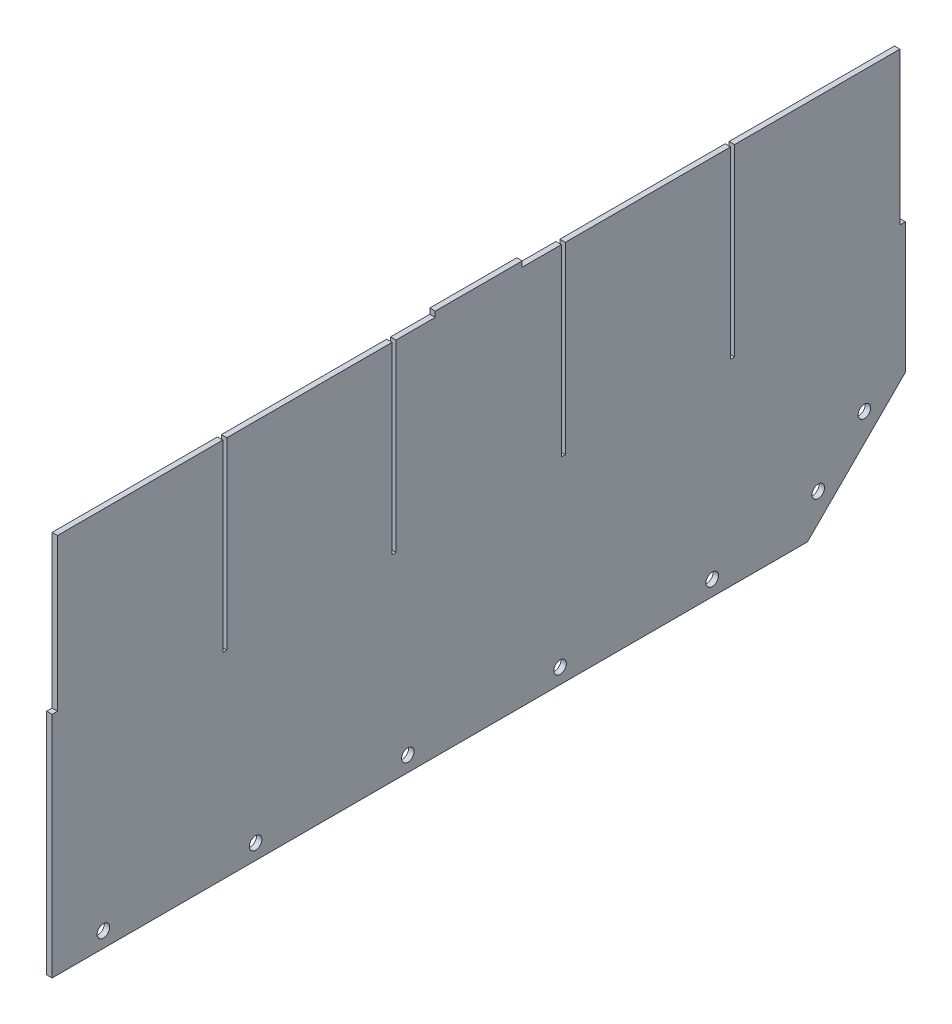
from build123d import *

# Parameters (mm, degrees)
SKETCH1_W           = 498.348
SKETCH1_H           = 165.1
BOSS_EXTRUDE1_DEPTH = 1.5875
BOSS_EXTRUDE2_DEPTH = 3.175
SKETCH3_R           = 3.675
CUT_EXTRUDE1_DEPTH  = 3.175
LPATTERN1_COUNT     = 5
LPATTERN1_PITCH     = 88.9
CUT_EXTRUDE2_DEPTH  = 286.681383539
LPATTERN2_COUNT     = 2
LPATTERN2_PITCH     = 38.1
SKETCH5_W           = 3.175
SKETCH5_H           = 88.9
CUT_EXTRUDE3_DEPTH  = 286.681383539
SKETCH6_W           = 2.286
SKETCH6_H           = 107.442
CUT_EXTRUDE4_DEPTH  = 286.681383539
LPATTERN3_COUNT     = 4
LPATTERN3_PITCH     = 98.8568
SKETCH7_W           = 50.8
SKETCH7_H           = 3.175
BOSS_EXTRUDE3_DEPTH = 3.175


with BuildPart() as part:
    # Sketch1 → Boss-Extrude1 (new, symmetric)
    with BuildSketch(Plane(origin=(0, 0, 0), x_dir=(0, 0, -1), z_dir=(1, 0, 0))):
        Rectangle(SKETCH1_W, SKETCH1_H)
    extrude(amount=BOSS_EXTRUDE1_DEPTH, both=True)

    # Sketch2 → Boss-Extrude2 (add)
    with BuildSketch(Plane(origin=(1.5875, 0, 0), x_dir=(0, 0, -1), z_dir=(1, 0, 0))):
        Polygon((-249.174, -139.7), (192.024, -139.7), (249.174, -82.55), (-249.174, -82.55), align=None)
    extrude(amount=-BOSS_EXTRUDE2_DEPTH)

    # Sketch3 → Cut-Extrude1 (cut)
    with BuildSketch(Plane(origin=(1.5875, 0, 0), x_dir=(0, 0, -1), z_dir=(1, 0, 0))):
        with Locations((-219.202, -130.81)):
            Circle(SKETCH3_R)
    cut_extrude1 = extrude(amount=-CUT_EXTRUDE1_DEPTH, mode=Mode.SUBTRACT)

    # LPattern1: Cut-Extrude1 ×5
    with Locations(*[(0, 0, -i * LPATTERN1_PITCH) for i in range(1, LPATTERN1_COUNT)]):
        add(cut_extrude1, mode=Mode.SUBTRACT)

    # Sketch4 → Cut-Extrude2 (cut, through all)
    with BuildSketch(Plane(origin=(1.5875, 0, 0), x_dir=(0, 0, -1), z_dir=(1, 0, 0))):
        with BuildLine():
            ThreePointArc((195.711561864, -119.847977118), (199.716540899, -120.644616979), (201.985179285, -117.249359697))
            ThreePointArc((201.985179285, -117.249359697), (196.903817671, -113.854102415), (195.711561864, -119.847977118))
        make_face()
    cut_extrude2 = extrude(amount=-CUT_EXTRUDE2_DEPTH, mode=Mode.SUBTRACT)

    # LPattern2: Cut-Extrude2 ×2
    with Locations(*[Vector(0, 0.7071067811865489, -0.7071067811865461) * (i * LPATTERN2_PITCH) for i in range(1, LPATTERN2_COUNT)]):
        add(cut_extrude2, mode=Mode.SUBTRACT)

    # Sketch5 → Cut-Extrude3 (cut, through all)
    with BuildSketch(Plane.ZY.offset(1.5875)):
        with Locations((-247.5865, 38.1)):
            Rectangle(SKETCH5_W, SKETCH5_H)
        with Locations((247.5865, 38.1)):
            Rectangle(SKETCH5_W, SKETCH5_H)
    extrude(amount=-CUT_EXTRUDE3_DEPTH, mode=Mode.SUBTRACT)

    # Sketch6 → Cut-Extrude4 (cut, through all)
    with BuildSketch(Plane.ZY.offset(1.5875)):
        with Locations((-148.2852, 28.829)):
            Rectangle(SKETCH6_W, SKETCH6_H)
    cut_extrude4 = extrude(amount=-CUT_EXTRUDE4_DEPTH, mode=Mode.SUBTRACT)

    # LPattern3: Cut-Extrude4 ×4
    with Locations(*[(0, 0, i * LPATTERN3_PITCH) for i in range(1, LPATTERN3_COUNT)]):
        add(cut_extrude4, mode=Mode.SUBTRACT)

    # Sketch7 → Boss-Extrude3 (add)
    with BuildSketch(Plane.ZY.offset(1.5875)):
        with Locations((0, 84.1375)):
            Rectangle(SKETCH7_W, SKETCH7_H)
    extrude(amount=-BOSS_EXTRUDE3_DEPTH)


solid = part.part
